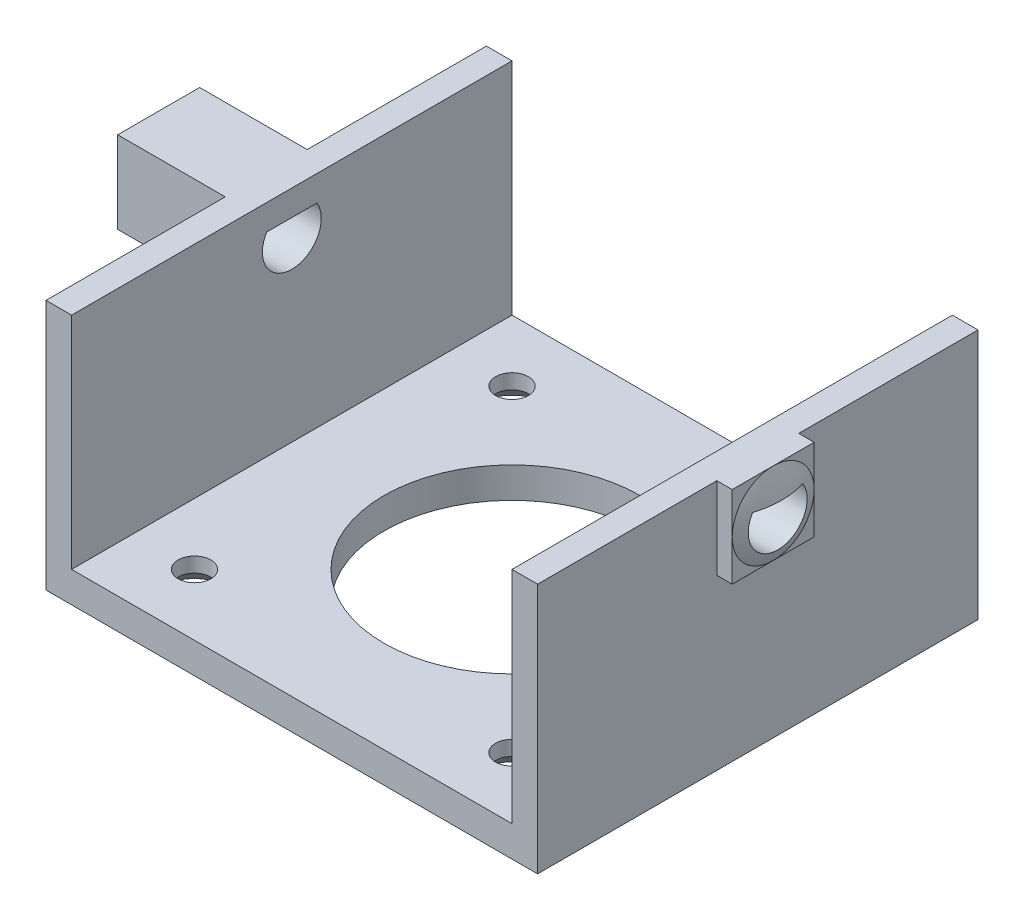
from build123d import *

# Parameters (mm, degrees)
SKETCH1_W                                           = 60
SKETCH1_H                                           = 8
BOSS_EXTRUDE1_DEPTH                                 = 8
BOSS_EXTRUDE2_DEPTH                                 = 17.5
BOSS_EXTRUDE2_DEPTH_BACK                            = 25.5
SKETCH5_W                                           = 43
SKETCH5_H                                           = 8
CUT_EXTRUDE2_DEPTH                                  = 17.5
SKETCH6_W                                           = 43
SKETCH6_H                                           = 8
BOSS_EXTRUDE3_DEPTH                                 = 2.5
SKETCH7_W                                           = 43
SKETCH7_H                                           = 8
BOSS_EXTRUDE4_DEPTH                                 = 2.5
CSK_FOR_M3_COUNTERSUNK_FLAT_HEAD_SCREW1_D           = 3.2
CSK_FOR_M3_COUNTERSUNK_FLAT_HEAD_SCREW1_CSINK_D     = 6.3
CSK_FOR_M3_COUNTERSUNK_FLAT_HEAD_SCREW1_CSINK_ANGLE = 90
SKETCH15_R                                          = 12.5
CUT_EXTRUDE3_DEPTH                                  = 5.5
CUT_EXTRUDE1_START                                  = -62.0000001
CUT_EXTRUDE1_DEPTH                                  = 62.0000001


with BuildPart() as part:
    # Sketch1 → Boss-Extrude1 (new body)
    with BuildSketch(Plane(origin=(0, 0, 0), x_dir=(1, 0, 0), z_dir=(0, 1, 0))):
        Rectangle(SKETCH1_W, SKETCH1_H)
    extrude(amount=BOSS_EXTRUDE1_DEPTH)

    # Sketch2 → Revolve1 (revolve)
    with BuildSketch(Plane(origin=(0, 4, 0), x_dir=(1, 0, 0), z_dir=(0, 1, 0))):
        with BuildLine():
            Line((30, 4), (30, 0))
            Line((30, 0), (31, 0))
            add(Edge.make_bspline(
                [(30, 4), (30.889676148, 2.05859871), (31, 0)],
                knots=[0, 0, 0, 1, 1, 1], degree=2))
        make_face()
    revolve1 = revolve(axis=Axis((30, 4, 0), (-1, 0, 0)))

    # Mirror1: Revolve1 across plane
    add(revolve1.mirror(Plane.ZY))

    # Sketch4 → Boss-Extrude2 (add, two sides: drawn at the far end of the back side and taken through both)
    with BuildSketch(Plane.XY.offset(4).offset(-BOSS_EXTRUDE2_DEPTH_BACK)):
        Polygon((28.5, 0), (26, 0), (26, -13.5), (-17, -13.5), (-17, 0), (-19.5, 0), (-19.5, -16.5), (28.5, -16.5), align=None)
    extrude(amount=BOSS_EXTRUDE2_DEPTH + BOSS_EXTRUDE2_DEPTH_BACK)

    # Sketch5 → Cut-Extrude2 (cut)
    with BuildSketch(Plane(origin=(0, 8, 0), x_dir=(1, 0, 0), z_dir=(0, 1, 0))):
        with Locations((4.5, 0)):
            Rectangle(SKETCH5_W, SKETCH5_H)
    extrude(amount=-CUT_EXTRUDE2_DEPTH, mode=Mode.SUBTRACT)

    # Sketch6 → Boss-Extrude3 (add)
    with BuildSketch(Plane.ZY.offset(-26)):
        with Locations((0, 4)):
            Rectangle(SKETCH6_W, SKETCH6_H)
    extrude(amount=-BOSS_EXTRUDE3_DEPTH)

    # Sketch7 → Boss-Extrude4 (add)
    with BuildSketch(Plane(origin=(-17, 0, 0), x_dir=(0, 0, -1), z_dir=(1, 0, 0))):
        with Locations((0, 4)):
            Rectangle(SKETCH7_W, SKETCH7_H)
    extrude(amount=-BOSS_EXTRUDE4_DEPTH)

    # CSK for M3 Countersunk Flat Head Screw1 (through all)
    with Locations(Plane(origin=(0, -16.5, 0), x_dir=(-1, 0, 0), z_dir=(0, -1, 0))):
        with Locations((11, -15.5), (-20, -15.5), (-20, 15.5), (11, 15.5)):
            CounterSinkHole(CSK_FOR_M3_COUNTERSUNK_FLAT_HEAD_SCREW1_D / 2, CSK_FOR_M3_COUNTERSUNK_FLAT_HEAD_SCREW1_CSINK_D / 2, counter_sink_angle=CSK_FOR_M3_COUNTERSUNK_FLAT_HEAD_SCREW1_CSINK_ANGLE)

    # Sketch15 → Cut-Extrude3 (cut)
    with BuildSketch(Plane(origin=(0, -16.5, 0), x_dir=(-1, 0, 0), z_dir=(0, -1, 0))):
        with Locations(Location((-4.5, 0, 0), (0, 0, 180))):
            Circle(SKETCH15_R)
    extrude(amount=-CUT_EXTRUDE3_DEPTH, mode=Mode.SUBTRACT)

    # Cut-Extrude1: read off the stored shape, not the designer's step
    # Cut-Extrude1 outline → Cut-Extrude1 (cut)
    with BuildSketch(Plane.ZY.offset(31).offset(CUT_EXTRUDE1_START)):
        with BuildLine():
            Line((2.452677109, 5.5), (-2.452677109, 5.5))
            ThreePointArc((-2.452677109, 5.5), (0, 1.125), (2.452677109, 5.5))
        make_face()
    extrude(amount=CUT_EXTRUDE1_DEPTH, mode=Mode.SUBTRACT)


solid = part.part
